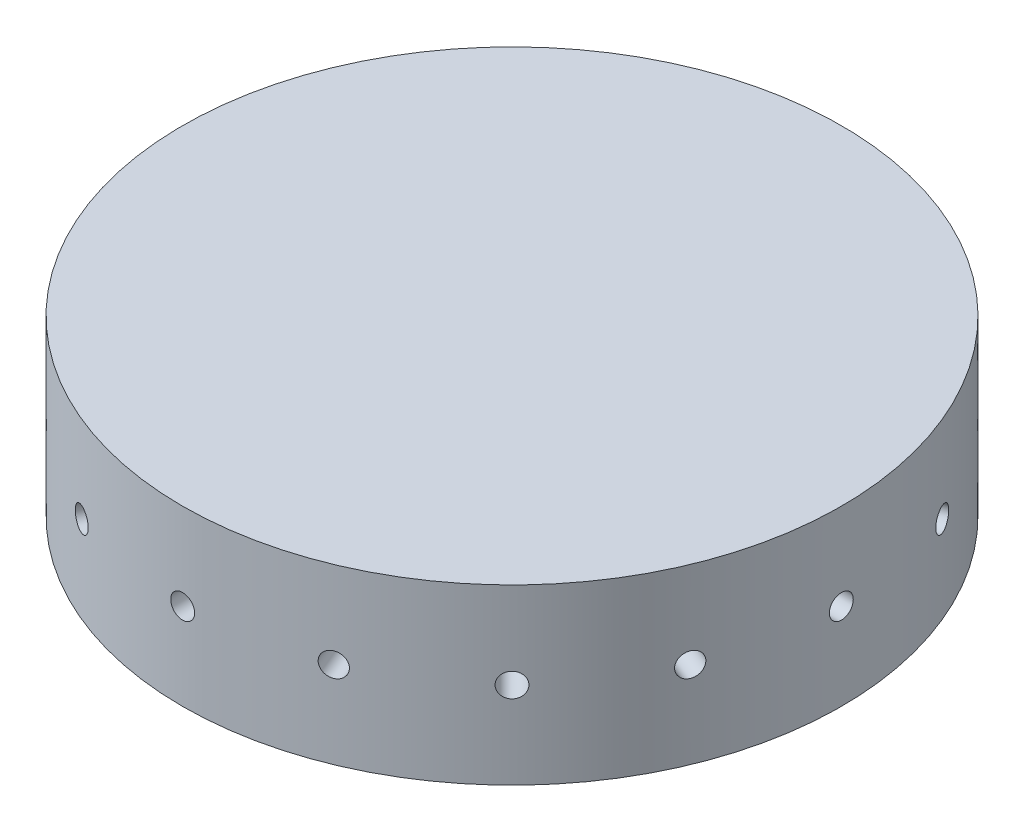
from build123d import *

# Parameters (mm, degrees)
SKETCH1_R           = 48.26
BOSS_EXTRUDE1_DEPTH = 25.4
SKETCH2_R           = 1.7526
SCREW_HOLE_DEPTH    = 12.7
HOLE_PATTERN_COUNT  = 16


with BuildPart() as part:
    # Sketch1 → Boss-Extrude1 (new body)
    with BuildSketch(Plane(origin=(0, 0, 0), x_dir=(1, 0, 0), z_dir=(0, 1, 0))):
        Circle(SKETCH1_R)
    extrude(amount=BOSS_EXTRUDE1_DEPTH)

    # Sketch2 → Screw Hole (cut)
    with BuildSketch(Plane.XY.offset(48.26)):
        with Locations((0, 12.7)):
            Circle(SKETCH2_R)
    screw_hole = extrude(amount=-SCREW_HOLE_DEPTH, mode=Mode.SUBTRACT)

    # Hole Pattern: Screw Hole ×16 about axis
    hole_pattern_axis = Axis((0, 25.4, 0), (0, -1, 0))
    for i in range(1, HOLE_PATTERN_COUNT):
        add(screw_hole.rotate(hole_pattern_axis, i * 360 / HOLE_PATTERN_COUNT), mode=Mode.SUBTRACT)


solid = part.part
